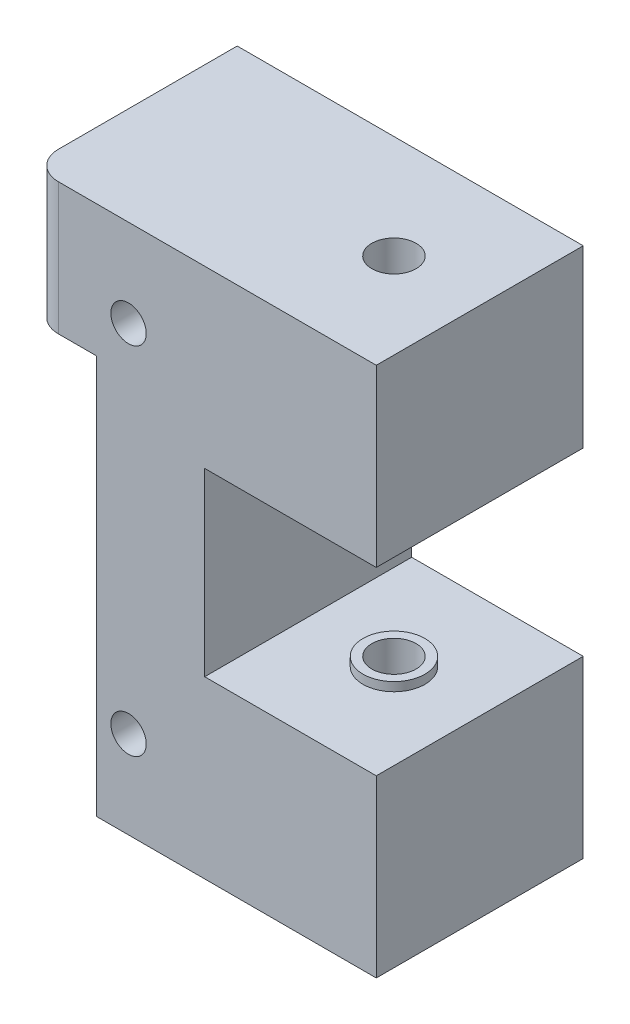
from build123d import *

# Parameters (mm, degrees)
MAINBLOCK_R                     = 2
MAINBLOCKBOSS_EXTRUDE1_DEPTH    = 23.4
TOPHOLECUT_SKETCH2_R            = 2.5
TOPHOLECUT_EXTRUDE1_DEPTH       = 45
TOPSPACERSKETCH4_R              = 3.5
TOPSPACERSKETCH4_R_2            = 2.5
TOPSPACERBOSS_EXTRUDE2_DEPTH    = 1
LOWERSPACERBOSS_EXTRUDE3_START  = 1
LOWERSPACERSKETCH5_R            = 3.5
LOWERSPACERSKETCH5_R_2          = 2.5
LOWERSPACERBOSS_EXTRUDE3_DEPTH  = 1
MOUNTHOLEBORECUT_EXTRUDE1_DEPTH = 2
PUSHPINHOLESKETCH1_R            = 1
PUSHPINHOLECUT_EXTRUDE1_DEPTH   = 76.354665582
MIDRAILINSETSKETCH1_W           = 7.5
MIDRAILINSETSKETCH1_H           = 45.1
MIDRAILINSETCUT_EXTRUDE2_DEPTH  = 76.354665582
VERTICALSUPPORTFILLET1_R        = 3.175


with BuildPart() as part:
    # MainBlock → MainBlockBoss-Extrude1 (new body)
    with BuildSketch(Plane.XY):
        Polygon((0, 0), (39.125, 0), (39.125, 19.8), (19.725, 19.8), (19.725, 40.2), (39.125, 40.2), (39.125, 60), (0, 60), align=None)
        with Locations((11.1125, 50.1)):
            Circle(MAINBLOCK_R, mode=Mode.SUBTRACT)
        with Locations((11.1125, 9.9)):
            Circle(MAINBLOCK_R, mode=Mode.SUBTRACT)
    extrude(amount=MAINBLOCKBOSS_EXTRUDE1_DEPTH)

    # TopHoleCut-Sketch2 → TopHoleCut-Extrude1 (cut)
    with BuildSketch(Plane(origin=(0, 60, 0), x_dir=(1, 0, 0), z_dir=(0, 1, 0))):
        with Locations((29.425, -11.7)):
            Circle(TOPHOLECUT_SKETCH2_R)
    extrude(amount=-TOPHOLECUT_EXTRUDE1_DEPTH, mode=Mode.SUBTRACT)

    # TopSpacerSketch4 → TopSpacerBoss-Extrude2 (add)
    with BuildSketch(Plane.XZ.offset(-40.2)):
        with Locations((29.425, 11.7)):
            Circle(TOPSPACERSKETCH4_R)
        with Locations((29.425, 11.7)):
            Circle(TOPSPACERSKETCH4_R_2, mode=Mode.SUBTRACT)
    extrude(amount=TOPSPACERBOSS_EXTRUDE2_DEPTH)

    # LowerSpacerSketch5 → LowerSpacerBoss-Extrude3 (add)
    with BuildSketch(Plane(origin=(0, 19.8, 0), x_dir=(1, 0, 0), z_dir=(0, 1, 0)).offset(LOWERSPACERBOSS_EXTRUDE3_START)):
        with Locations((29.425, -11.7)):
            Circle(LOWERSPACERSKETCH5_R)
        with Locations((29.425, -11.7)):
            Circle(LOWERSPACERSKETCH5_R_2, mode=Mode.SUBTRACT)
    extrude(amount=-LOWERSPACERBOSS_EXTRUDE3_DEPTH)

    # MountHoleBoreSketch1 → MountHoleBoreCut-Extrude1 (cut)
    with BuildSketch(Plane(origin=(0, 0, 0), x_dir=(-1, 0, 0), z_dir=(0, 0, -1))):
        Polygon((-7.2375, 50.1), (-9.175, 53.45584844), (-13.05, 53.45584844), (-14.9875, 50.1), (-13.05, 46.74415156), (-9.175, 46.74415156), align=None)
        Polygon((-7.2375, 9.9), (-9.175, 13.25584844), (-13.05, 13.25584844), (-14.9875, 9.9), (-13.05, 6.54415156), (-9.175, 6.54415156), align=None)
    extrude(amount=-MOUNTHOLEBORECUT_EXTRUDE1_DEPTH, mode=Mode.SUBTRACT)

    # PushPinHoleSketch1 → PushPinHoleCut-Extrude1 (cut, through all)
    with BuildSketch(Plane.XZ):
        with Locations((29.425, 11.7)):
            Circle(PUSHPINHOLESKETCH1_R)
    extrude(amount=-PUSHPINHOLECUT_EXTRUDE1_DEPTH, mode=Mode.SUBTRACT)

    # MidRailInsetSketch1 → MidRailInsetCut-Extrude2 (cut, through all)
    with BuildSketch(Plane(origin=(0, 0, 0), x_dir=(-1, 0, 0), z_dir=(0, 0, -1))):
        with Locations((-3.75, 22.55)):
            Rectangle(MIDRAILINSETSKETCH1_W, MIDRAILINSETSKETCH1_H)
    extrude(amount=-MIDRAILINSETCUT_EXTRUDE2_DEPTH, mode=Mode.SUBTRACT)

    # VerticalSupportFillet1
    verticalsupportfillet1_edges = [part.edges().sort_by_distance(p)[0] for p in [
        (0, 52.55, 23.4),
    ]]
    fillet(verticalsupportfillet1_edges, radius=VERTICALSUPPORTFILLET1_R)


solid = part.part
